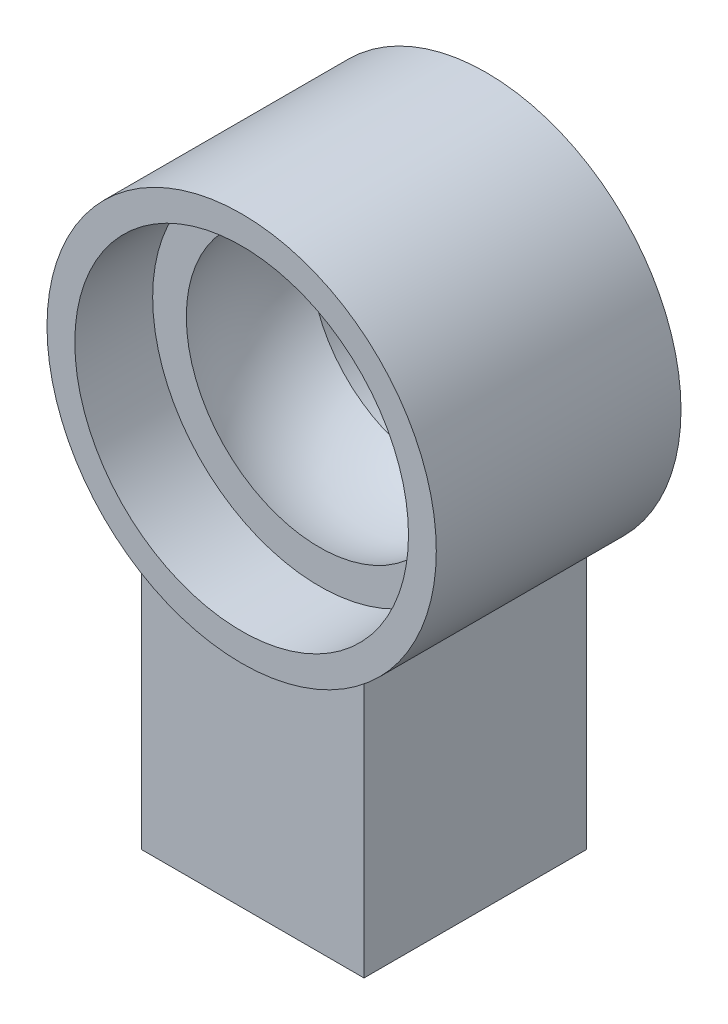
from build123d import *

# Parameters (mm, degrees)
SOCKET_OUTER_EYE_AND_MOUTHS_START              = -2.2
SKETCH1_R                                      = 3.5
SKETCH1_R_2                                    = 2.2
SOCKET_OUTER_EYE_AND_MOUTHS_DEPTH              = 4.4
ROD_CONNECTION_NECK_START                      = -2
SKETCH2_W                                      = 4
SKETCH2_H                                      = 5.3
ROD_CONNECTION_NECK_DEPTH                      = 4
SKETCH3_R                                      = 1.05
D2P1_ROD_BOND_BORE_DEPTH                       = 2.7
SKETCH4_R                                      = 3
REVB_M6X0P35_CAP_FEMALE_THREAD_MAJOR_POC_DEPTH = 1.4


# Read off the part's stored shape, not the designer's step: Spherical_Socket_D5p05
with BuildPart() as part:
    # Sketch1 → Socket_Outer_Eye_And_Mouths (new body)
    with BuildSketch(Plane.XY.offset(SOCKET_OUTER_EYE_AND_MOUTHS_START)):
        Circle(SKETCH1_R)
        Circle(SKETCH1_R_2, mode=Mode.SUBTRACT)
    extrude(amount=SOCKET_OUTER_EYE_AND_MOUTHS_DEPTH)

    # Sketch2 → Rod_Connection_Neck (add)
    with BuildSketch(Plane.XY.offset(ROD_CONNECTION_NECK_START)):
        with Locations((0, -4.85)):
            Rectangle(SKETCH2_W, SKETCH2_H)
    extrude(amount=ROD_CONNECTION_NECK_DEPTH)

    # Spherical_Socket_D5p05 outline → Spherical_Socket_D5p05 (revolve, cut)
    with BuildSketch(Plane.XZ):
        with BuildLine():
            Line((2.199999999, 1.239203375), (2.199999999, -1.239203375))
            ThreePointArc((2.199999999, -1.239203375), (2.525, 0), (2.199999999, 1.239203375))
        make_face()
    revolve(axis=Axis((0, 0, 0), (0, 0, 1)), mode=Mode.SUBTRACT)

    # Sketch3 → D2p1_Rod_Bond_Bore (cut)
    with BuildSketch(Plane.XZ.offset(7.5)):
        with Locations(Location((0, 0, 0), (0, 0, 270))):
            Circle(SKETCH3_R)
    extrude(amount=-D2P1_ROD_BOND_BORE_DEPTH, mode=Mode.SUBTRACT)

    # Sketch4 → RevB_M6x0p35_Cap_Female_Thread_Major_Pocket (cut)
    with BuildSketch(Plane.XY.offset(2.2)):
        Circle(SKETCH4_R)
    extrude(amount=-REVB_M6X0P35_CAP_FEMALE_THREAD_MAJOR_POC_DEPTH, mode=Mode.SUBTRACT)


solid = part.part
